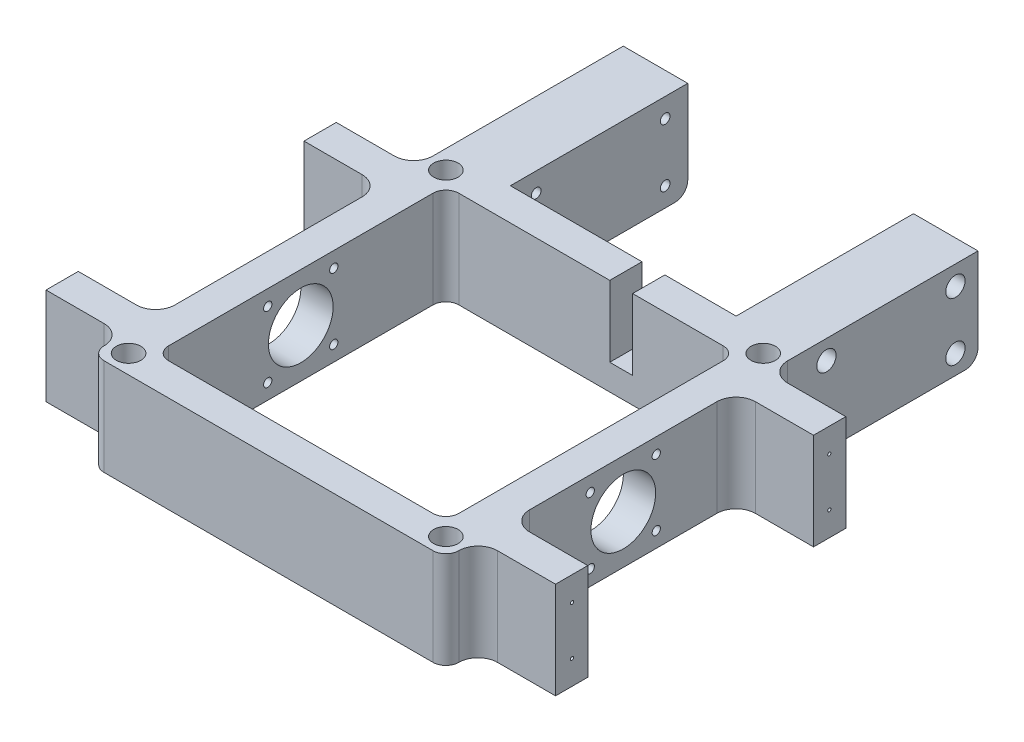
from build123d import *

# Parameters (mm, degrees)
SKETCH1_W           = 25.4
SKETCH1_H           = 69.85
SKETCH1_R           = 4.826
SKETCH1_W_2         = 114.3
SKETCH1_H_2         = 114.3
BOSS_EXTRUDE2_DEPTH = 38.1
CUT_EXTRUDE1_REACH  = 203.206
SKETCH5_R           = 1.63195
SKETCH5_R_2         = 12.75
SKETCH7_W           = 12.7
SKETCH7_H           = 27.94
CUT_EXTRUDE2_DEPTH  = 4.5
CUT_EXTRUDE3_REACH  = 203.206
SKETCH10_R          = 1.905
SKETCH10_3_R        = 3.81
SKETCH10_3_R_2      = 1.905
CUT_EXTRUDE4_DEPTH  = 15.24
CUT_EXTRUDE5_START  = -15.24
SKETCH11_R          = 3.81
CUT_EXTRUDE5_DEPTH  = 15.24
FILLET10_R          = 5.08
FILLET11_R          = 5.08
FILLET12_R          = 5.08
FILLET13_R          = 5.08
FILLET14_R          = 5.08
FILLET15_R          = 5.08
FILLET16_R          = 5.08
SKETCH12_W          = 12.7
SKETCH12_H          = 38.1
BOSS_EXTRUDE3_DEPTH = 30.48
SKETCH14_R          = 0.635
CUT_EXTRUDE6_DEPTH  = 25.4
FILLET17_R          = 7.62
FILLET18_R          = 7.62
FILLET19_R          = 7.62
FILLET20_R          = 7.62
FILLET21_R          = 7.62
FILLET22_R          = 7.62
FILLET23_R          = 7.62
FILLET24_R          = 7.62


with BuildPart() as part:
    # Sketch1 → Boss-Extrude2 (new body)
    # profile 1 of 3: a face of its own
    with BuildSketch(Plane(origin=(0, 0, 0), x_dir=(1, 0, 0), z_dir=(0, 1, 0))):
        with Locations((-57.15, 104.775)):
            Rectangle(SKETCH1_W, SKETCH1_H)
    # profile 2 of 3: a face of its own
    with BuildSketch(Plane(origin=(0, 0, 0), x_dir=(1, 0, 0), z_dir=(0, 1, 0))):
        Polygon((-44.45, 69.85), (-69.85, 69.85), (-69.85, -69.85), (69.85, -69.85), (69.85, 69.85), (44.45, 69.85), (-31.75, 69.85), align=None)
        with Locations(Location((-62.484, -62.484, 0), (0, 0, 90))):
            Circle(SKETCH1_R, mode=Mode.SUBTRACT)
        Rectangle(SKETCH1_W_2, SKETCH1_H_2, mode=Mode.SUBTRACT)
        with Locations(Location((62.484, -62.484, 0), (0, 0, 90))):
            Circle(SKETCH1_R, mode=Mode.SUBTRACT)
        with Locations(Location((-62.484, 62.484, 0), (0, 0, 90))):
            Circle(SKETCH1_R, mode=Mode.SUBTRACT)
        with Locations(Location((62.484, 62.484, 0), (0, 0, 90))):
            Circle(SKETCH1_R, mode=Mode.SUBTRACT)
    # profile 3 of 3: a face of its own
    with BuildSketch(Plane(origin=(0, 0, 0), x_dir=(1, 0, 0), z_dir=(0, 1, 0))):
        with Locations((57.15, 104.775)):
            Rectangle(SKETCH1_W, SKETCH1_H)
    extrude(amount=BOSS_EXTRUDE2_DEPTH)

    # Cut-Extrude1: up to this face of the body (flat: up to its plane)
    cut_extrude1_end = Plane(part.part.faces().sort_by_distance((-69.85, 19.05, -34.925))[0])
    # Sketch5 → Cut-Extrude1 (cut, up to the picked face)
    with BuildSketch(Plane(origin=(69.85, 0, 0), x_dir=(0, 0, -1), z_dir=(1, 0, 0)), mode=Mode.PRIVATE) as cut_extrude1_sk1:
        with Locations((-13, 32.05)):
            Circle(SKETCH5_R)
    cut_extrude1_tool1 = split(extrude(cut_extrude1_sk1.sketch, amount=-CUT_EXTRUDE1_REACH, mode=Mode.PRIVATE), bisect_by=cut_extrude1_end, keep=Keep.BOTH, mode=Mode.PRIVATE)
    # Sketch5 → Cut-Extrude1 (cut, up to the picked face)
    with BuildSketch(Plane(origin=(69.85, 0, 0), x_dir=(0, 0, -1), z_dir=(1, 0, 0)), mode=Mode.PRIVATE) as cut_extrude1_sk2:
        with Locations((13, 6.05)):
            Circle(SKETCH5_R)
    cut_extrude1_tool2 = split(extrude(cut_extrude1_sk2.sketch, amount=-CUT_EXTRUDE1_REACH, mode=Mode.PRIVATE), bisect_by=cut_extrude1_end, keep=Keep.BOTH, mode=Mode.PRIVATE)
    # Sketch5 → Cut-Extrude1 (cut, up to the picked face)
    with BuildSketch(Plane(origin=(69.85, 0, 0), x_dir=(0, 0, -1), z_dir=(1, 0, 0)), mode=Mode.PRIVATE) as cut_extrude1_sk3:
        with Locations((-13, 6.05)):
            Circle(SKETCH5_R)
    cut_extrude1_tool3 = split(extrude(cut_extrude1_sk3.sketch, amount=-CUT_EXTRUDE1_REACH, mode=Mode.PRIVATE), bisect_by=cut_extrude1_end, keep=Keep.BOTH, mode=Mode.PRIVATE)
    # Sketch5 → Cut-Extrude1 (cut, up to the picked face)
    with BuildSketch(Plane(origin=(69.85, 0, 0), x_dir=(0, 0, -1), z_dir=(1, 0, 0)), mode=Mode.PRIVATE) as cut_extrude1_sk4:
        with Locations((13, 32.05)):
            Circle(SKETCH5_R)
    cut_extrude1_tool4 = split(extrude(cut_extrude1_sk4.sketch, amount=-CUT_EXTRUDE1_REACH, mode=Mode.PRIVATE), bisect_by=cut_extrude1_end, keep=Keep.BOTH, mode=Mode.PRIVATE)
    # Sketch5 → Cut-Extrude1 (cut, up to the picked face)
    with BuildSketch(Plane(origin=(69.85, 0, 0), x_dir=(0, 0, -1), z_dir=(1, 0, 0)), mode=Mode.PRIVATE) as cut_extrude1_sk5:
        with Locations((0, 19.05)):
            Circle(SKETCH5_R_2)
    cut_extrude1_tool5 = split(extrude(cut_extrude1_sk5.sketch, amount=-CUT_EXTRUDE1_REACH, mode=Mode.PRIVATE), bisect_by=cut_extrude1_end, keep=Keep.BOTH, mode=Mode.PRIVATE)
    add(cut_extrude1_tool1.solids().sort_by(Axis((69.85, 32.05, 13), (-1, 0, 0)))[0], mode=Mode.SUBTRACT)
    add(cut_extrude1_tool2.solids().sort_by(Axis((69.85, 6.05, -13), (-1, 0, 0)))[0], mode=Mode.SUBTRACT)
    add(cut_extrude1_tool3.solids().sort_by(Axis((69.85, 6.05, 13), (-1, 0, 0)))[0], mode=Mode.SUBTRACT)
    add(cut_extrude1_tool4.solids().sort_by(Axis((69.85, 32.05, -13), (-1, 0, 0)))[0], mode=Mode.SUBTRACT)
    add(cut_extrude1_tool5.solids().sort_by(Axis((69.85, 19.05, 0), (-1, 0, 0)))[0], mode=Mode.SUBTRACT)

    # Sketch7 → Cut-Extrude2 (cut, symmetric)
    with BuildSketch(Plane.ZY.offset(-11.879999989)):
        with Locations((-63.5, 24.13)):
            Rectangle(SKETCH7_W, SKETCH7_H)
    extrude(amount=CUT_EXTRUDE2_DEPTH, both=True, mode=Mode.SUBTRACT)

    # Cut-Extrude3: up to this face of the body (flat: up to its plane)
    cut_extrude3_end = Plane(part.part.faces().sort_by_distance((-69.85, 19.05, -37.47957558))[0])
    # Sketch10 → Cut-Extrude3 (cut, up to the picked face)
    with BuildSketch(Plane(origin=(69.85, 0, 0), x_dir=(0, 0, -1), z_dir=(1, 0, 0)), mode=Mode.PRIVATE) as cut_extrude3_sk1:
        with Locations((80.01, 30.48)):
            Circle(SKETCH10_R)
    cut_extrude3_tool1 = split(extrude(cut_extrude3_sk1.sketch, amount=-CUT_EXTRUDE3_REACH, mode=Mode.PRIVATE), bisect_by=cut_extrude3_end, keep=Keep.BOTH, mode=Mode.PRIVATE)
    # Sketch10 → Cut-Extrude3 (cut, up to the picked face)
    with BuildSketch(Plane(origin=(69.85, 0, 0), x_dir=(0, 0, -1), z_dir=(1, 0, 0)), mode=Mode.PRIVATE) as cut_extrude3_sk2:
        with Locations((80.01, 7.62)):
            Circle(SKETCH10_R)
    cut_extrude3_tool2 = split(extrude(cut_extrude3_sk2.sketch, amount=-CUT_EXTRUDE3_REACH, mode=Mode.PRIVATE), bisect_by=cut_extrude3_end, keep=Keep.BOTH, mode=Mode.PRIVATE)
    # Sketch10 → Cut-Extrude3 (cut, up to the picked face)
    with BuildSketch(Plane(origin=(69.85, 0, 0), x_dir=(0, 0, -1), z_dir=(1, 0, 0)), mode=Mode.PRIVATE) as cut_extrude3_sk3:
        with Locations((130.81, 30.48)):
            Circle(SKETCH10_R)
    cut_extrude3_tool3 = split(extrude(cut_extrude3_sk3.sketch, amount=-CUT_EXTRUDE3_REACH, mode=Mode.PRIVATE), bisect_by=cut_extrude3_end, keep=Keep.BOTH, mode=Mode.PRIVATE)
    # Sketch10 → Cut-Extrude3 (cut, up to the picked face)
    with BuildSketch(Plane(origin=(69.85, 0, 0), x_dir=(0, 0, -1), z_dir=(1, 0, 0)), mode=Mode.PRIVATE) as cut_extrude3_sk4:
        with Locations((130.81, 7.62)):
            Circle(SKETCH10_R)
    cut_extrude3_tool4 = split(extrude(cut_extrude3_sk4.sketch, amount=-CUT_EXTRUDE3_REACH, mode=Mode.PRIVATE), bisect_by=cut_extrude3_end, keep=Keep.BOTH, mode=Mode.PRIVATE)
    add(cut_extrude3_tool1.solids().sort_by(Axis((69.85, 30.48, -80.01), (-1, 0, 0)))[0], mode=Mode.SUBTRACT)
    add(cut_extrude3_tool2.solids().sort_by(Axis((69.85, 7.62, -80.01), (-1, 0, 0)))[0], mode=Mode.SUBTRACT)
    add(cut_extrude3_tool3.solids().sort_by(Axis((69.85, 30.48, -130.81), (-1, 0, 0)))[0], mode=Mode.SUBTRACT)
    add(cut_extrude3_tool4.solids().sort_by(Axis((69.85, 7.62, -130.81), (-1, 0, 0)))[0], mode=Mode.SUBTRACT)

    # Sketch10<3> → Cut-Extrude4 (cut)
    # profile 1 of 4: a face of its own
    with BuildSketch(Plane(origin=(69.85, 0, 0), x_dir=(0, 0, -1), z_dir=(1, 0, 0))):
        with Locations((80.01, 30.48)):
            Circle(SKETCH10_3_R)
        with Locations((80.01, 30.48)):
            Circle(SKETCH10_3_R_2, mode=Mode.SUBTRACT)
    # profile 2 of 4: a face of its own
    with BuildSketch(Plane(origin=(69.85, 0, 0), x_dir=(0, 0, -1), z_dir=(1, 0, 0))):
        with Locations((130.81, 7.62)):
            Circle(SKETCH10_3_R)
        with Locations((130.81, 7.62)):
            Circle(SKETCH10_3_R_2, mode=Mode.SUBTRACT)
    # profile 3 of 4: a face of its own
    with BuildSketch(Plane(origin=(69.85, 0, 0), x_dir=(0, 0, -1), z_dir=(1, 0, 0))):
        with Locations((130.81, 30.48)):
            Circle(SKETCH10_3_R)
        with Locations((130.81, 30.48)):
            Circle(SKETCH10_3_R_2, mode=Mode.SUBTRACT)
    # profile 4 of 4: a face of its own
    with BuildSketch(Plane(origin=(69.85, 0, 0), x_dir=(0, 0, -1), z_dir=(1, 0, 0))):
        with Locations((80.01, 7.62)):
            Circle(SKETCH10_3_R)
        with Locations((80.01, 7.62)):
            Circle(SKETCH10_3_R_2, mode=Mode.SUBTRACT)
    extrude(amount=-CUT_EXTRUDE4_DEPTH, mode=Mode.SUBTRACT)

    # Sketch11 → Cut-Extrude5 (cut)
    with BuildSketch(Plane.ZY.offset(69.85).offset(CUT_EXTRUDE5_START)):
        with Locations(Location((-130.81, 30.48, 0), (0, 0, 180))):
            Circle(SKETCH11_R)
        with Locations(Location((-80.01, 7.62, 0), (0, 0, 180))):
            Circle(SKETCH11_R)
        with Locations(Location((-80.01, 30.48, 0), (0, 0, 180))):
            Circle(SKETCH11_R)
        with Locations(Location((-130.81, 7.62, 0), (0, 0, 180))):
            Circle(SKETCH11_R)
    extrude(amount=CUT_EXTRUDE5_DEPTH, mode=Mode.SUBTRACT)

    # Fillet10
    fillet10_edges = [part.edges().sort_by_distance(p)[0] for p in [
        (57.15, 19.05, -57.15),
    ]]
    fillet(fillet10_edges, radius=FILLET10_R)

    # Fillet11
    fillet11_edges = [part.edges().sort_by_distance(p)[0] for p in [
        (-57.15, 19.05, -57.15),
    ]]
    fillet(fillet11_edges, radius=FILLET11_R)

    # Fillet12
    fillet12_edges = [part.edges().sort_by_distance(p)[0] for p in [
        (-57.15, 19.05, 57.15),
    ]]
    fillet(fillet12_edges, radius=FILLET12_R)

    # Fillet13
    fillet13_edges = [part.edges().sort_by_distance(p)[0] for p in [
        (57.15, 19.05, 57.15),
    ]]
    fillet(fillet13_edges, radius=FILLET13_R)

    # Fillet14
    fillet14_edges = [part.edges().sort_by_distance(p)[0] for p in [
        (-57.15, 0, -139.7),
        (57.15, 0, -139.7),
    ]]
    fillet(fillet14_edges, radius=FILLET14_R)

    # Fillet15
    fillet15_edges = [part.edges().sort_by_distance(p)[0] for p in [
        (-69.85, 19.05, 69.85),
    ]]
    fillet(fillet15_edges, radius=FILLET15_R)

    # Fillet16
    fillet16_edges = [part.edges().sort_by_distance(p)[0] for p in [
        (69.85, 19.05, 69.85),
    ]]
    fillet(fillet16_edges, radius=FILLET16_R)

    # Sketch12 → Boss-Extrude3 (add)
    with BuildSketch(Plane.ZY.offset(69.85)):
        with Locations((50.8, 19.05)):
            Rectangle(SKETCH12_W, SKETCH12_H)
        with Locations((-50.8, 19.05)):
            Rectangle(SKETCH12_W, SKETCH12_H)
    boss_extrude3 = extrude(amount=BOSS_EXTRUDE3_DEPTH)

    # Sketch14 → Cut-Extrude6 (cut)
    with BuildSketch(Plane.ZY.offset(100.33)):
        with Locations((50.673, 9.525)):
            Circle(SKETCH14_R)
        with Locations((50.673, 28.575)):
            Circle(SKETCH14_R)
        with Locations((-50.673, 28.575)):
            Circle(SKETCH14_R)
        with Locations((-50.673, 9.525)):
            Circle(SKETCH14_R)
    cut_extrude6 = extrude(amount=-CUT_EXTRUDE6_DEPTH, mode=Mode.SUBTRACT)

    # Mirror1: Boss-Extrude3, Cut-Extrude6 across plane
    add(boss_extrude3.mirror(Plane(origin=(0, 0, 0), x_dir=(0, 0, 1), z_dir=(1, 0, 0))))
    add(cut_extrude6.mirror(Plane(origin=(0, 0, 0), x_dir=(0, 0, 1), z_dir=(1, 0, 0))), mode=Mode.SUBTRACT)

    # Fillet17
    fillet17_edges = [part.edges().sort_by_distance(p)[0] for p in [
        (-69.85, 19.05, -57.15),
    ]]
    fillet(fillet17_edges, radius=FILLET17_R)

    # Fillet18
    fillet18_edges = [part.edges().sort_by_distance(p)[0] for p in [
        (-69.85, 19.05, -44.45),
    ]]
    fillet(fillet18_edges, radius=FILLET18_R)

    # Fillet19
    fillet19_edges = [part.edges().sort_by_distance(p)[0] for p in [
        (-69.85, 19.05, 44.45),
    ]]
    fillet(fillet19_edges, radius=FILLET19_R)

    # Fillet20
    fillet20_edges = [part.edges().sort_by_distance(p)[0] for p in [
        (-69.85, 19.05, 57.15),
    ]]
    fillet(fillet20_edges, radius=FILLET20_R - 0.0001)  # a hair under: the kernel refuses the full size

    # Fillet21
    fillet21_edges = [part.edges().sort_by_distance(p)[0] for p in [
        (69.85, 19.05, 57.15),
    ]]
    fillet(fillet21_edges, radius=FILLET21_R - 0.0001)  # a hair under: the kernel refuses the full size

    # Fillet22
    fillet22_edges = [part.edges().sort_by_distance(p)[0] for p in [
        (69.85, 19.05, 44.45),
    ]]
    fillet(fillet22_edges, radius=FILLET22_R)

    # Fillet23
    fillet23_edges = [part.edges().sort_by_distance(p)[0] for p in [
        (69.85, 19.05, -57.15),
    ]]
    fillet(fillet23_edges, radius=FILLET23_R)

    # Fillet24
    fillet24_edges = [part.edges().sort_by_distance(p)[0] for p in [
        (69.85, 19.05, -44.45),
    ]]
    fillet(fillet24_edges, radius=FILLET24_R)


solid = part.part
